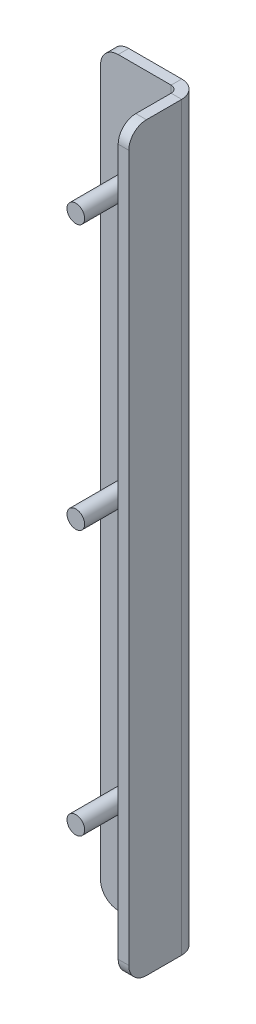
from build123d import *

# Parameters (mm, degrees)
SKETCH_1_W                       = 25
SKETCH_1_H                       = 210
SM_BASE_FLANGE_1_DEPTH           = 3
SM_EDGE_FLANGE_1_STRIP_W         = 16
SM_EDGE_FLANGE_1_STRIP_H         = 3
SM_EDGE_FLANGE_1_STRIP_CUT_DEPTH = 210
SM_EDGE_FLANGE_1_DEPTH           = 210
SKETCH_9_R                       = 2.5
EXTRUDE_1_DEPTH                  = 15
FILLET_1_R                       = 5


# Sheet-metal steps are written as plain solids
with BuildPart() as part:
    # Sketch 1 → 基体-法兰1 (new body)
    with BuildSketch(Plane.XY):
        Rectangle(SKETCH_1_W, SKETCH_1_H)
    extrude(amount=-SM_BASE_FLANGE_1_DEPTH)

    # 边线-法兰1 strip (across the edge) → 边线-法兰1 strip cut (cut)
    with BuildSketch(Plane(origin=(12.5, -105, 0), x_dir=(-1, 0, 0), z_dir=(0, 1, 0))):
        with Locations((-3, -1.5)):
            Rectangle(SM_EDGE_FLANGE_1_STRIP_W, SM_EDGE_FLANGE_1_STRIP_H)
    extrude(amount=SM_EDGE_FLANGE_1_STRIP_CUT_DEPTH, mode=Mode.SUBTRACT)

    # 边线-法兰1 section (across the edge) → 边线-法兰1 (add)
    with BuildSketch(Plane(origin=(12.5, -105, 0), x_dir=(-1, 0, 0), z_dir=(0, 1, 0))):
        with BuildLine():
            Line((0, 2), (0, 17))
            Line((0, 17), (3, 17))
            Line((3, 17), (3, 2))
            ThreePointArc((3, 2), (3.585786438, 0.585786438), (5, 0))
            Line((5, 0), (5, -3))
            ThreePointArc((5, -3), (1.464466094, -1.535533906), (0, 2))
        make_face()
    extrude(amount=SM_EDGE_FLANGE_1_DEPTH)

    # 草图9 → 凸台-拉伸1 (add)
    with BuildSketch(Plane.XY):
        with Locations((-4.5, 0)):
            Circle(SKETCH_9_R)
        with Locations((-4.5, -75)):
            Circle(SKETCH_9_R)
        with Locations((-4.5, 75)):
            Circle(SKETCH_9_R)
    extrude(amount=EXTRUDE_1_DEPTH)

    # 圆角1
    fillet_1_edges = [part.edges().sort_by_distance(p)[0] for p in [
        (11, -105, 17),
        (11, 105, 17),
        (-12.5, -105, -1.5),
        (-12.5, 105, -1.5),
    ]]
    fillet(fillet_1_edges, radius=FILLET_1_R)


solid = part.part
